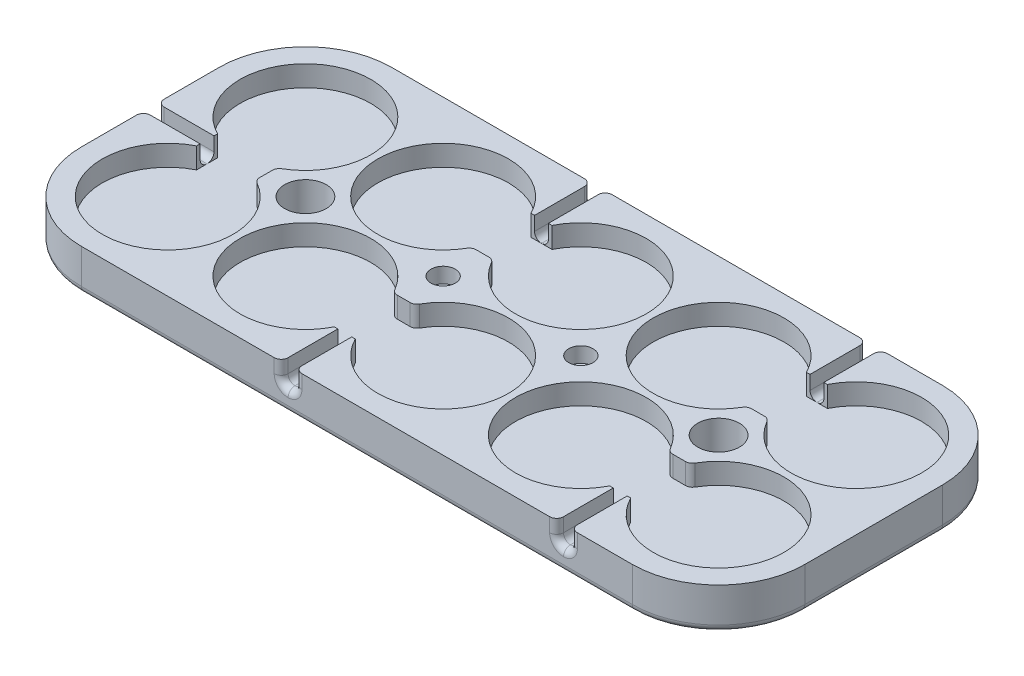
from build123d import *

# Parameters (mm, degrees)
SKETCH2_R               = 9.425
BOSS_EXTRUDE1_DEPTH     = 3
BOSS_EXTRUDE2_START     = -3
SKETCH3_R               = 12.425
BOSS_EXTRUDE2_DEPTH     = 3
SKETCH4_W               = 19.85
SKETCH4_H               = 8.5
SKETCH4_W_2             = 8.5
SKETCH4_H_2             = 19.85
CUT_EXTRUDE1_DEPTH      = 57.793821187
SKETCH5_W               = 2
SKETCH5_H               = 11.675
SKETCH5_W_2             = 11.675
SKETCH5_H_2             = 2
CUT_EXTRUDE2_DEPTH      = 57.793821187
CUT_EXTRUDE3_DEPTH      = 57.793821187
CUT_EXTRUDE3_DEPTH_BACK = 57.793821187
SKETCH7_R               = 3
SKETCH7_R_2             = 1.75
SKETCH8_R               = 3
CUT_EXTRUDE4_DEPTH      = 3.5
FILLET1_R               = 1
FILLET2_R               = 1
CUT_EXTRUDE5_DEPTH      = 0.5
SKETCH10_R              = 3
BOSS_EXTRUDE3_DEPTH     = 0.3


with BuildPart() as part:
    # Sketch2 → Boss-Extrude1 (new body)
    with BuildSketch(Plane(origin=(0, 0, 0), x_dir=(1, 0, 0), z_dir=(0, 1, 0))):
        with BuildLine():
            Line((-39.7, -22.35), (39.7, -22.35))
            ThreePointArc((39.7, -22.35), (48.485801756, -18.710801756), (52.125, -9.925))
            Line((52.125, -9.925), (52.125, 9.925))
            ThreePointArc((52.125, 9.925), (48.485801756, 18.710801756), (39.7, 22.35))
            Line((39.7, 22.35), (-39.7, 22.35))
            ThreePointArc((-39.7, 22.35), (-48.485801756, 18.710801756), (-52.125, 9.925))
            Line((-52.125, 9.925), (-52.125, -9.925))
            ThreePointArc((-52.125, -9.925), (-48.485801756, -18.710801756), (-39.7, -22.35))
        make_face()
        with Locations(Location((-19.85, 9.925, 0), (0, 0, 270))):
            Circle(SKETCH2_R, mode=Mode.SUBTRACT)
        with Locations(Location((-39.7, -9.925, 0), (0, 0, 270))):
            Circle(SKETCH2_R, mode=Mode.SUBTRACT)
        with Locations(Location((-39.7, 9.925, 0), (0, 0, 270))):
            Circle(SKETCH2_R, mode=Mode.SUBTRACT)
        with Locations(Location((-19.85, -9.925, 0), (0, 0, 270))):
            Circle(SKETCH2_R, mode=Mode.SUBTRACT)
        with Locations(Location((19.85, -9.925, 0), (0, 0, 270))):
            Circle(SKETCH2_R, mode=Mode.SUBTRACT)
        with Locations(Location((39.7, 9.925, 0), (0, 0, 270))):
            Circle(SKETCH2_R, mode=Mode.SUBTRACT)
        with Locations(Location((39.7, -9.925, 0), (0, 0, 270))):
            Circle(SKETCH2_R, mode=Mode.SUBTRACT)
        with Locations(Location((19.85, 9.925, 0), (0, 0, 270))):
            Circle(SKETCH2_R, mode=Mode.SUBTRACT)
        with Locations(Location((0, -9.925, 0), (0, 0, 270))):
            Circle(SKETCH2_R, mode=Mode.SUBTRACT)
        with Locations(Location((0, 9.925, 0), (0, 0, 270))):
            Circle(SKETCH2_R, mode=Mode.SUBTRACT)
    extrude(amount=BOSS_EXTRUDE1_DEPTH)

    # Sketch3 → Boss-Extrude2 (add)
    with BuildSketch(Plane(origin=(0, 0, 0), x_dir=(1, 0, 0), z_dir=(0, 1, 0)).offset(BOSS_EXTRUDE2_START)):
        with BuildLine():
            ThreePointArc((-27.275, -9.925), (-30.914198244, -18.710801756), (-39.7, -22.35))
            Line((-39.7, -22.35), (39.700000108, -22.35))
            ThreePointArc((39.700000108, -22.35), (27.916563549, -13.865970744), (32.225041806, 0))
            ThreePointArc((32.225041806, 0), (27.916563532, 13.865970693), (39.7, 22.35))
            Line((39.7, 22.35), (-39.7, 22.35))
            ThreePointArc((-39.7, 22.35), (-30.914198244, 18.710801756), (-27.275, 9.925))
            ThreePointArc((-27.275, 9.925), (-28.581165066, 4.379539269), (-32.225041806, 0))
            ThreePointArc((-32.225041806, 0), (-28.581165066, -4.379539269), (-27.275, -9.925))
        make_face()
        with Locations((-39.7, 9.925)):
            Circle(SKETCH3_R)
        with Locations((-39.7, -9.925)):
            Circle(SKETCH3_R)
        with BuildLine():
            Line((-52.125, 9.924999978), (-52.125, -9.925))
            ThreePointArc((-52.125, -9.925), (-50.818834934, -4.379539269), (-47.174958194, 0))
            ThreePointArc((-47.174958194, 0), (-50.818834929, 4.379539259), (-52.125, 9.924999978))
        make_face()
        with Locations((39.7, -9.925)):
            Circle(SKETCH3_R)
        with Locations((39.7, 9.925)):
            Circle(SKETCH3_R)
        with BuildLine():
            ThreePointArc((47.174958194, 0), (50.818834934, -4.379539269), (52.125, -9.925))
            Line((52.125, -9.925), (52.125, 9.925))
            ThreePointArc((52.125, 9.925), (50.818834934, 4.379539269), (47.174958194, 0))
        make_face()
    extrude(amount=BOSS_EXTRUDE2_DEPTH)

    # Sketch4 → Cut-Extrude1 (cut, through all)
    with BuildSketch(Plane(origin=(0, 0, 0), x_dir=(1, 0, 0), z_dir=(0, 1, 0))):
        with Locations((29.775, -9.925)):
            Rectangle(SKETCH4_W, SKETCH4_H)
        with Locations((-9.925, -9.925)):
            Rectangle(SKETCH4_W, SKETCH4_H)
        with Locations((-39.7, 0)):
            Rectangle(SKETCH4_W_2, SKETCH4_H_2)
        with Locations((-9.925, 9.925)):
            Rectangle(SKETCH4_W, SKETCH4_H)
        with Locations((29.775, 9.925)):
            Rectangle(SKETCH4_W, SKETCH4_H)
    extrude(amount=CUT_EXTRUDE1_DEPTH, mode=Mode.SUBTRACT)

    # Sketch5 → Cut-Extrude2 (cut, through all)
    with BuildSketch(Plane(origin=(0, 0, 0), x_dir=(1, 0, 0), z_dir=(0, 1, 0))):
        with Locations((-9.925, 16.5125)):
            Rectangle(SKETCH5_W, SKETCH5_H)
        with Locations((29.775, 16.5125)):
            Rectangle(SKETCH5_W, SKETCH5_H)
        with Locations((29.775, -16.5125)):
            Rectangle(SKETCH5_W, SKETCH5_H)
        with Locations((-9.925, -16.5125)):
            Rectangle(SKETCH5_W, SKETCH5_H)
        with Locations((-46.2875, 0)):
            Rectangle(SKETCH5_W_2, SKETCH5_H_2)
    extrude(amount=CUT_EXTRUDE2_DEPTH, mode=Mode.SUBTRACT)

    # Sketch7 → Cut-Extrude3 (cut, two sides: drawn at the far end of the back side and taken through both)
    with BuildSketch(Plane(origin=(0, 0, 0), x_dir=(1, 0, 0), z_dir=(0, 1, 0)).offset(-CUT_EXTRUDE3_DEPTH_BACK)):
        with Locations(Location((-29.775, 0, 0), (0, 0, 270))):
            Circle(SKETCH7_R)
        with Locations(Location((-9.925, 0, 0), (0, 0, 270))):
            Circle(SKETCH7_R_2)
        with Locations(Location((9.925, 0, 0), (0, 0, 270))):
            Circle(SKETCH7_R_2)
        with Locations(Location((29.775, 0, 0), (0, 0, 270))):
            Circle(SKETCH7_R)
    extrude(amount=CUT_EXTRUDE3_DEPTH + CUT_EXTRUDE3_DEPTH_BACK, mode=Mode.SUBTRACT)

    # Sketch8 → Cut-Extrude4 (cut)
    with BuildSketch(Plane.XZ.offset(3)):
        with Locations(Location((9.925, 0, 0), (0, 0, 270))):
            Circle(SKETCH8_R)
        with Locations(Location((-9.925, 0, 0), (0, 0, 270))):
            Circle(SKETCH8_R)
    extrude(amount=-CUT_EXTRUDE4_DEPTH, mode=Mode.SUBTRACT)

    # Fillet1
    fillet1_edges = [part.edges().sort_by_distance(p)[0] for p in [
        (28.775, 0, 18.2625),
        (30.775, 0, 18.2625),
        (-8.925, 0, 18.2625),
        (-10.925, 0, 18.2625),
        (-48.0375, 0, 1),
        (-48.0375, 0, -1),
        (-10.925, 0, -18.2625),
        (-8.925, 0, -18.2625),
        (28.775, 0, -18.2625),
        (30.775, 0, -18.2625),
    ]]
    fillet(fillet1_edges, radius=FILLET1_R - 0.0001)  # a hair under: the kernel refuses the full size
    fillet1_2_edges = [part.edges().sort_by_distance(p)[0] for p in [
        (28.775, 1.99995, 22.35),
        (30.775, 1.99995, 22.35),
        (-10.925, 1.99995, 22.35),
        (-8.925, 1.99995, 22.35),
        (-52.125, 1.99995, 1),
        (-52.125, 1.99995, -1),
        (-8.925, 1.99995, -22.35),
        (-10.925, 1.99995, -22.35),
        (30.775, 1.99995, -22.35),
        (28.775, 1.99995, -22.35),
        (28.262379271, 1.5, 5.675),
        (31.287620729, 1.5, 5.675),
        (-8.412379271, 1.5, 5.675),
        (-11.437620729, 1.5, 5.675),
        (-35.45, 1.5, -1.512620729),
        (-35.45, 1.5, 1.512620729),
        (-11.437620729, 1.5, -5.675),
        (-8.412379271, 1.5, -5.675),
        (28.262379271, 1.5, -5.675),
        (31.287620729, 1.5, -5.675),
        (29.067863929, 0.292863929, -22.35),
        (30.482136071, 0.292863929, -22.35),
        (-10.632136071, 0.292863929, -22.35),
        (-9.217863929, 0.292863929, -22.35),
        (-52.125, 0.292863929, -0.707136071),
        (-52.125, 0.292863929, 0.707136071),
        (-9.217863929, 0.292863929, 22.35),
        (-10.632136071, 0.292863929, 22.35),
        (30.482136071, 0.292863929, 22.35),
        (29.067863929, 0.292863929, 22.35),
    ]]
    fillet(fillet1_2_edges, radius=FILLET1_R)

    # Fillet2
    fillet2_edges = [part.edges().sort_by_distance(p)[0] for p in [
        (48.485801794, -3, 18.710801718),
        (5.4e-08, -3, 22.35),
        (-48.485801756, -3, 18.710801756),
        (-48.485801764, -3, -18.710801748),
        (48.485801756, -3, -18.710801756),
        (52.125, -3, 0),
        (-52.125, -3, 1.1e-08),
        (0, -3, -22.35),
    ]]
    fillet(fillet2_edges, radius=FILLET2_R)

    # Sketch9 → Cut-Extrude5 (cut)
    # profile 1 of 10: a face of its own
    with BuildSketch(Plane.XZ.offset(3)):
        Polygon((-41.93125, -3.371875), (-41.93125, -1.990625), (-40.30625, -1.990625), (-40.30625, -0.379589844), (-39.0875, -0.379589844), (-39.0875, -1.990625), (-37.4625, -1.990625), (-37.4625, -3.371875), (-39.0875, -3.371875), (-39.0875, -4.990527344), (-40.30625, -4.990527344), (-40.30625, -3.371875), align=None)
    # profile 2 of 10: a face of its own
    with BuildSketch(Plane.XZ.offset(3)):
        with BuildLine():
            Line((-37.70625, 1.155273438), (-37.70625, 3.003710938))
            Line((-37.70625, 3.003710938), (-38.913574219, 3.2296875))
            add(Edge.make_bspline(
                [(-38.913574219, 3.2296875), (-38.888354447, 3.195004202), (-38.838357858, 3.126246777), (-38.775816936, 3.016215044), (-38.719833196, 2.904684269), (-38.67723522, 2.78804962), (-38.642859865, 2.668424819), (-38.616912947, 2.545512106), (-38.603260829, 2.418768552), (-38.601095778, 2.333427364), (-38.6, 2.290234375)],
                knots=[0, 0, 0, 0, 1.019769699, 2.021628385, 3.008030164, 3.986378705, 4.97133988, 5.968784958, 6.971958885, 8, 8, 8, 8], degree=3))
            add(Edge.make_bspline(
                [(-38.6, 2.290234375), (-38.601776673, 2.216478332), (-38.605285814, 2.070801375), (-38.638472169, 1.856507366), (-38.690195164, 1.649702893), (-38.762963563, 1.451812524), (-38.852441456, 1.264849333), (-38.957887633, 1.090464117), (-39.076393572, 0.928545879), (-39.212214447, 0.783101653), (-39.357772298, 0.650132327), (-39.515952873, 0.534442847), (-39.684877452, 0.434760373), (-39.863331803, 0.35124336), (-40.050292843, 0.284690145), (-40.244416524, 0.238412025), (-40.444476066, 0.207371634), (-40.580350356, 0.204550731), (-40.649023437, 0.203125)],
                knots=[0, 0, 0, 0, 1.08625284, 2.145478562, 3.187603353, 4.223364536, 5.24703985, 6.237405749, 7.222752121, 8.198101564, 9.165041285, 10.124227595, 11.080388489, 12.051261812, 13.023656128, 13.999244784, 14.988785689, 16, 16, 16, 16], degree=3))
            add(Edge.make_bspline(
                [(-40.649023437, 0.203125), (-40.748287249, 0.206500481), (-40.943979002, 0.213155008), (-41.230986695, 0.267278708), (-41.506409805, 0.353523058), (-41.724281776, 0.45550631), (-41.89025101, 0.553052891), (-42.00877063, 0.636245926), (-42.121501816, 0.727539988), (-42.228798042, 0.826832695), (-42.329203199, 0.935167651), (-42.423474592, 1.052200786), (-42.510461285, 1.178515088), (-42.59360878, 1.311000229), (-42.666782038, 1.451604635), (-42.730391319, 1.598533193), (-42.78537166, 1.751002104), (-42.829267075, 1.909391367), (-42.864081019, 2.073003985), (-42.887445682, 2.242319957), (-42.903514638, 2.417302861), (-42.905330585, 2.536063056), (-42.90625, 2.596191406)],
                knots=[0, 0, 0, 0, 1.614845366, 3.183556158, 4.736945776, 6.3025528, 7.087021627, 7.868642129, 8.657243818, 9.446897877, 10.24628748, 11.059624568, 11.890909107, 12.741604561, 13.604347575, 14.468189976, 15.346307227, 16.240516445, 17.141677189, 18.067180109, 19.021412259, 20, 20, 20, 20], degree=3))
            add(Edge.make_bspline(
                [(-42.90625, 2.596191406), (-42.905064552, 2.659260334), (-42.902739024, 2.782984469), (-42.890746152, 2.964073511), (-42.867733633, 3.136163094), (-42.835714553, 3.298786798), (-42.797210898, 3.453224783), (-42.7475896, 3.597878655), (-42.688840905, 3.733654406), (-42.600751388, 3.898698676), (-42.478712582, 4.084235441), (-42.318070744, 4.276878388), (-42.146291593, 4.435985956), (-41.963119588, 4.555142779), (-41.780882792, 4.643988216), (-41.608320574, 4.710093255), (-41.445241965, 4.751180813), (-41.339428964, 4.756791595), (-41.288867188, 4.759472656)],
                knots=[0, 0, 0, 0, 1.013582185, 1.988373401, 2.914513124, 3.801374318, 4.650762859, 5.470085016, 6.255844122, 7.025459743, 8.473948101, 9.815657502, 11.047961438, 12.221074907, 13.312848151, 14.300551696, 15.187934143, 16, 16, 16, 16], degree=3))
            add(Edge.make_bspline(
                [(-41.288867188, 4.759472656), (-41.256500223, 4.757413713), (-41.191716453, 4.753292656), (-41.096203093, 4.722540138), (-41.005743276, 4.669822799), (-40.919535264, 4.601596699), (-40.844409247, 4.518029499), (-40.7904347, 4.420306725), (-40.755243869, 4.312855213), (-40.752163764, 4.237130747), (-40.750585937, 4.198339844)],
                knots=[0, 0, 0, 0, 0.904042773, 1.809477692, 2.773527107, 3.817381096, 4.873497324, 5.890390631, 6.919323454, 8, 8, 8, 8], degree=3))
            add(Edge.make_bspline(
                [(-40.750585937, 4.198339844), (-40.752154462, 4.159744719), (-40.755176802, 4.085377018), (-40.775458965, 3.977739743), (-40.811256871, 3.879239982), (-40.861353473, 3.789210338), (-40.92534359, 3.70820298), (-41.004961529, 3.637613685), (-41.097666395, 3.575222495), (-41.166930612, 3.542375029), (-41.202539063, 3.525488281)],
                knots=[0, 0, 0, 0, 1.070872181, 2.063429057, 3.025512209, 3.966438538, 4.910875251, 5.875320226, 6.907710805, 8, 8, 8, 8], degree=3))
            add(Edge.make_bspline(
                [(-41.202539063, 3.525488281), (-41.261732716, 3.496869957), (-41.375089147, 3.442065584), (-41.525854614, 3.340448049), (-41.653944646, 3.23126204), (-41.756104899, 3.111247627), (-41.834498163, 2.984668147), (-41.889660873, 2.853536704), (-41.924574856, 2.718175964), (-41.929016786, 2.626019738), (-41.93125, 2.5796875)],
                knots=[0, 0, 0, 0, 1.246173256, 2.38643411, 3.439441567, 4.430594302, 5.364333449, 6.253179032, 7.121772564, 8, 8, 8, 8], degree=3))
            add(Edge.make_bspline(
                [(-41.93125, 2.5796875), (-41.929949637, 2.53083351), (-41.927425054, 2.435986163), (-41.895947262, 2.299075778), (-41.85020936, 2.171205783), (-41.78262806, 2.054271989), (-41.698641709, 1.949177595), (-41.599342386, 1.854825097), (-41.484420918, 1.773920323), (-41.355351723, 1.705043174), (-41.213794743, 1.650695799), (-41.061382418, 1.613637776), (-40.900407726, 1.587957318), (-40.78962488, 1.585589355), (-40.7328125, 1.584375)],
                knots=[0, 0, 0, 0, 1.004414075, 1.950014914, 2.879565473, 3.793282912, 4.717750338, 5.642751983, 6.605517642, 7.603974128, 8.649867825, 9.719756986, 10.830630925, 12, 12, 12, 12], degree=3))
            add(Edge.make_bspline(
                [(-40.7328125, 1.584375), (-40.672223282, 1.586183284), (-40.555615568, 1.58966344), (-40.387547428, 1.613329623), (-40.233992195, 1.655235913), (-40.094919341, 1.713604175), (-39.971823569, 1.786307292), (-39.863429357, 1.868611369), (-39.773237248, 1.964001127), (-39.700930381, 2.069857725), (-39.644578647, 2.184174186), (-39.604035406, 2.304952897), (-39.578874181, 2.432228716), (-39.576305455, 2.51905667), (-39.575, 2.563183594)],
                knots=[0, 0, 0, 0, 1.27823599, 2.46004456, 3.571179967, 4.627444697, 5.631916714, 6.58018035, 7.489612449, 8.38855397, 9.274949741, 10.169936726, 11.069941664, 12, 12, 12, 12], degree=3))
            add(Edge.make_bspline(
                [(-39.575, 2.563183594), (-39.575271785, 2.609800224), (-39.575772414, 2.69566841), (-39.590472202, 2.813171966), (-39.609477648, 2.910222396), (-39.645019257, 2.991622727), (-39.697867096, 3.071063721), (-39.76276327, 3.170276159), (-39.851266145, 3.292073184), (-39.956547873, 3.429253872), (-40.058691479, 3.576019475), (-40.134617241, 3.725040571), (-40.183308124, 3.868655764), (-40.190031034, 3.963569179), (-40.193261719, 4.009179688)],
                knots=[0, 0, 0, 0, 1.040838944, 1.917233242, 2.644627811, 3.242022575, 3.887710035, 4.774405358, 5.892648842, 7.250913045, 8.641303185, 9.880711888, 10.98157908, 12, 12, 12, 12], degree=3))
            add(Edge.make_bspline(
                [(-40.193261719, 4.009179688), (-40.191621724, 4.048377277), (-40.188386183, 4.125710094), (-40.153057046, 4.236760628), (-40.098712453, 4.340473578), (-40.024620072, 4.434299595), (-39.935957371, 4.512586522), (-39.839553004, 4.573757691), (-39.734399746, 4.609365368), (-39.662000643, 4.613798063), (-39.62578125, 4.616015625)],
                knots=[0, 0, 0, 0, 1.023616867, 2.019490913, 3.021024079, 4.078760992, 5.130907536, 6.10614948, 7.052555734, 8, 8, 8, 8], degree=3))
            add(Edge.make_bspline(
                [(-39.62578125, 4.616015625), (-39.615186891, 4.615300431), (-39.584519577, 4.613230172), (-39.524661358, 4.602624129), (-39.435610549, 4.589573573), (-39.366762869, 4.577314252), (-39.327441406, 4.5703125)],
                knots=[0, 0, 0, 0, 0.421823084, 1.221044272, 2.412835351, 4, 4, 4, 4], degree=3))
            Line((-39.327441406, 4.5703125), (-37.317773438, 4.217382813))
            add(Edge.make_bspline(
                [(-37.317773438, 4.217382813), (-37.258132131, 4.205820351), (-37.145079254, 4.183903165), (-36.990111419, 4.128784716), (-36.858236368, 4.061045553), (-36.74940187, 3.975646089), (-36.665980854, 3.866331322), (-36.607857209, 3.732452168), (-36.574078383, 3.572413006), (-36.570608649, 3.457533915), (-36.56875, 3.395996094)],
                knots=[0, 0, 0, 0, 1.170661162, 2.219042838, 3.16128212, 4.020649716, 4.864876015, 5.785830123, 6.813925249, 8, 8, 8, 8], degree=3))
            Line((-36.56875, 3.395996094), (-36.56875, 1.180664063))
            add(Edge.make_bspline(
                [(-36.56875, 1.180664063), (-36.570244509, 1.117513411), (-36.573048509, 0.999030018), (-36.598922153, 0.832998107), (-36.64375982, 0.692019237), (-36.706355812, 0.574658767), (-36.788915033, 0.482526216), (-36.892263991, 0.418924186), (-37.012415083, 0.37938413), (-37.098664246, 0.375353642), (-37.143847656, 0.373242188)],
                knots=[0, 0, 0, 0, 1.344730686, 2.522986704, 3.56640363, 4.482312437, 5.337369367, 6.167786367, 7.040156946, 8, 8, 8, 8], degree=3))
            add(Edge.make_bspline(
                [(-37.143847656, 0.373242188), (-37.180989021, 0.375686162), (-37.254619477, 0.380531191), (-37.360219201, 0.419751035), (-37.457465456, 0.48256755), (-37.545357459, 0.569473642), (-37.618804015, 0.681827257), (-37.669899338, 0.81959761), (-37.701705498, 0.979902254), (-37.704677532, 1.094592318), (-37.70625, 1.155273438)],
                knots=[0, 0, 0, 0, 0.826265408, 1.638019978, 2.478174968, 3.392219469, 4.373568936, 5.445905295, 6.648659502, 8, 8, 8, 8], degree=3))
        make_face()
    # profile 3 of 10: a face of its own
    with BuildSketch(Plane.XZ.offset(3)):
        with BuildLine():
            add(Edge.make_bspline(
                [(-12.644335938, -9.15), (-12.586589295, -9.147582359), (-12.474091138, -9.142872472), (-12.311915745, -9.105572296), (-12.163347415, -9.042279828), (-12.051384837, -8.969371804), (-11.97217234, -8.898824265), (-11.919560064, -8.840473608), (-11.876227225, -8.776085445), (-11.840068951, -8.706791468), (-11.812515968, -8.631604667), (-11.791864361, -8.551305474), (-11.780599872, -8.465197797), (-11.779225011, -8.406085877), (-11.778515625, -8.375585937)],
                knots=[0, 0, 0, 0, 1.588922051, 3.095431968, 4.55195291, 6.015911772, 6.750344642, 7.468325924, 8.172850126, 8.881601128, 9.615294202, 10.372660857, 11.160342861, 12, 12, 12, 12], degree=3))
            add(Edge.make_bspline(
                [(-11.778515625, -8.375585937), (-11.780940094, -8.330052772), (-11.785691884, -8.240810968), (-11.823822553, -8.112128419), (-11.887968431, -7.994282978), (-11.975196924, -7.887981674), (-12.084712501, -7.79845234), (-12.214276886, -7.732478802), (-12.362858552, -7.693877677), (-12.467635013, -7.689690832), (-12.522460938, -7.6875)],
                knots=[0, 0, 0, 0, 0.962640342, 1.886707414, 2.812509498, 3.786255046, 4.779539858, 5.785068332, 6.841002323, 8, 8, 8, 8], degree=3))
            add(Edge.make_bspline(
                [(-12.522460938, -7.6875), (-12.555893358, -7.68845483), (-12.61907575, -7.690259319), (-12.709115615, -7.69763789), (-12.787914773, -7.716240426), (-12.878015535, -7.745225047), (-12.97626107, -7.799416903), (-13.055833756, -7.876336891), (-13.111969883, -7.95019182), (-13.154385131, -8.017107139), (-13.197730261, -8.095880701), (-13.256803449, -8.212651726), (-13.323681873, -8.361985016), (-13.377636746, -8.480143129), (-13.403515625, -8.536816406)],
                knots=[0, 0, 0, 0, 0.904989055, 1.710297113, 2.437899308, 3.089491427, 4.268063784, 5.434116808, 6.054598845, 6.775415668, 7.574844294, 8.486110305, 10.314600321, 12, 12, 12, 12], degree=3))
            add(Edge.make_bspline(
                [(-13.403515625, -8.536816406), (-13.41302027, -8.550954521), (-13.433325345, -8.581158224), (-13.480679061, -8.616863538), (-13.53823644, -8.65334666), (-13.635298497, -8.695971687), (-13.774075258, -8.737657299), (-13.891485891, -8.742516838), (-13.951953125, -8.745019531)],
                knots=[0, 0, 0, 0, 0.502291102, 1.073060463, 1.738596173, 2.525307356, 4.210510845, 6, 6, 6, 6], degree=3))
            add(Edge.make_bspline(
                [(-13.951953125, -8.745019531), (-13.985181842, -8.743021688), (-14.05125056, -8.739049373), (-14.147115058, -8.708183309), (-14.237720225, -8.658484248), (-14.321772836, -8.591107602), (-14.393069129, -8.505978915), (-14.44641057, -8.406492568), (-14.477340641, -8.29318124), (-14.480814633, -8.213700964), (-14.482617188, -8.172460937)],
                knots=[0, 0, 0, 0, 0.917417596, 1.824103036, 2.756029669, 3.762874785, 4.784566943, 5.805253663, 6.861209319, 8, 8, 8, 8], degree=3))
            add(Edge.make_bspline(
                [(-14.482617188, -8.172460937), (-14.480891173, -8.132528572), (-14.477383604, -8.051378903), (-14.448459629, -7.929611354), (-14.405467507, -7.8058502), (-14.34381658, -7.681113715), (-14.26473047, -7.557513354), (-14.171106846, -7.435350375), (-14.060202835, -7.31851195), (-13.936593493, -7.203785781), (-13.795657962, -7.096812922), (-13.637030341, -7.002319984), (-13.464000624, -6.916237398), (-13.274759035, -6.845389665), (-13.073394321, -6.784443617), (-12.859338609, -6.743803327), (-12.635255664, -6.717570556), (-12.48233597, -6.714211879), (-12.404394531, -6.7125)],
                knots=[0, 0, 0, 0, 0.687665124, 1.397457831, 2.147322746, 2.943422878, 3.789436066, 4.673713908, 5.592469244, 6.563166905, 7.578694088, 8.635921147, 9.741960392, 10.905797436, 12.115380376, 13.36442633, 14.656677908, 16, 16, 16, 16], degree=3))
            add(Edge.make_bspline(
                [(-12.404394531, -6.7125), (-12.331976646, -6.713946261), (-12.189731242, -6.716787052), (-11.980687817, -6.73965201), (-11.780982322, -6.779540097), (-11.590535658, -6.832216833), (-11.410781888, -6.899680252), (-11.243389169, -6.980240325), (-11.089083863, -7.075320499), (-10.949347977, -7.1827752), (-10.823235744, -7.299028235), (-10.714381777, -7.424024122), (-10.623515778, -7.557147123), (-10.549904588, -7.697058206), (-10.492481757, -7.842254448), (-10.451615223, -7.992064305), (-10.426776393, -8.145810148), (-10.424032102, -8.249811808), (-10.42265625, -8.301953125)],
                knots=[0, 0, 0, 0, 1.225107078, 2.406392441, 3.552210207, 4.667510872, 5.746030394, 6.796375209, 7.805802999, 8.80681598, 9.774471105, 10.703308983, 11.604924289, 12.495296676, 13.372823065, 14.241306182, 15.118277406, 16, 16, 16, 16], degree=3))
            add(Edge.make_bspline(
                [(-10.42265625, -8.301953125), (-10.424528504, -8.369851517), (-10.428160533, -8.501569149), (-10.465660085, -8.692165283), (-10.522577058, -8.869952115), (-10.607625328, -9.033167057), (-10.712010729, -9.184047461), (-10.830902664, -9.329289585), (-10.967621203, -9.466021724), (-11.0693556, -9.548659594), (-11.120898438, -9.590527344)],
                knots=[0, 0, 0, 0, 1.068493578, 2.072794954, 3.049015524, 4.000257127, 4.960059425, 5.935847279, 6.954215185, 8, 8, 8, 8], degree=3))
            add(Edge.make_bspline(
                [(-11.120898438, -9.590527344), (-11.073819925, -9.615015052), (-10.978805602, -9.66443639), (-10.845138981, -9.755692998), (-10.715983066, -9.857286426), (-10.595279046, -9.971008871), (-10.484142726, -10.092673), (-10.387383491, -10.220868252), (-10.306045467, -10.354211158), (-10.241884761, -10.493058001), (-10.190227221, -10.635576958), (-10.154840857, -10.783353503), (-10.132702947, -10.935559307), (-10.129659072, -11.038987093), (-10.128125, -11.091113281)],
                knots=[0, 0, 0, 0, 1.00625233, 2.030828509, 3.065551735, 4.122322673, 5.174108021, 6.189198351, 7.165688209, 8.132120304, 9.087207882, 10.037726527, 11.011041016, 12, 12, 12, 12], degree=3))
            add(Edge.make_bspline(
                [(-10.128125, -11.091113281), (-10.130165435, -11.153857543), (-10.134254184, -11.279588373), (-10.164851929, -11.467112668), (-10.212933262, -11.653559573), (-10.281611942, -11.836816833), (-10.36876837, -12.015409852), (-10.478256887, -12.184715338), (-10.605042559, -12.346900444), (-10.753082013, -12.497534547), (-10.917650561, -12.636910806), (-11.098951514, -12.762792432), (-11.298711082, -12.869801858), (-11.512416632, -12.964270628), (-11.741083876, -13.039260491), (-11.982716003, -13.091830008), (-12.235816717, -13.126400745), (-12.40893251, -13.129614031), (-12.497070313, -13.13125)],
                knots=[0, 0, 0, 0, 0.865116607, 1.733574129, 2.614147439, 3.517277987, 4.42829596, 5.349596062, 6.293093627, 7.26308448, 8.257066179, 9.264123562, 10.301066281, 11.377915821, 12.483550515, 13.613627803, 14.785035159, 16, 16, 16, 16], degree=3))
            add(Edge.make_bspline(
                [(-12.497070313, -13.13125), (-12.582258819, -13.1292133), (-12.748282205, -13.125243988), (-12.990682235, -13.089653256), (-13.219627024, -13.033731426), (-13.433347684, -12.952671051), (-13.630294318, -12.855248796), (-13.810645858, -12.745333356), (-13.973988485, -12.625347517), (-14.117587596, -12.492712119), (-14.24247209, -12.352446913), (-14.353739821, -12.210578569), (-14.448395192, -12.06544214), (-14.524850341, -11.919096321), (-14.585562014, -11.777627316), (-14.628600317, -11.645418812), (-14.658209738, -11.525314873), (-14.662258651, -11.448418021), (-14.664160156, -11.412304687)],
                knots=[0, 0, 0, 0, 1.352749266, 2.636365181, 3.883815623, 5.090148188, 6.259800183, 7.370213415, 8.4419304, 9.474464176, 10.469453221, 11.422962127, 12.336745574, 13.217916145, 14.043357411, 14.779004771, 15.426579817, 16, 16, 16, 16], degree=3))
            add(Edge.make_bspline(
                [(-14.664160156, -11.412304687), (-14.662172628, -11.368453451), (-14.658323528, -11.28353), (-14.622672954, -11.163488813), (-14.56638764, -11.055769392), (-14.484751919, -10.966377968), (-14.388546694, -10.892394923), (-14.2790546, -10.83845913), (-14.158667768, -10.805491726), (-14.074886988, -10.802119516), (-14.031933594, -10.800390625)],
                knots=[0, 0, 0, 0, 1.065566147, 2.063603226, 3.022673671, 4.000932909, 4.986224236, 5.963342773, 6.955830415, 8, 8, 8, 8], degree=3))
            add(Edge.make_bspline(
                [(-14.031933594, -10.800390625), (-14.002666143, -10.801794939), (-13.944940466, -10.804564739), (-13.859637005, -10.821158405), (-13.777774135, -10.8509411), (-13.701486485, -10.891149907), (-13.632936946, -10.934969535), (-13.578485452, -10.981272974), (-13.534325129, -11.024673782), (-13.518660916, -11.058832037), (-13.511425781, -11.074609375)],
                knots=[0, 0, 0, 0, 1.143080217, 2.2545551, 3.37824436, 4.53107536, 5.617207074, 6.543824975, 7.327408127, 8, 8, 8, 8], degree=3))
            add(Edge.make_bspline(
                [(-13.511425781, -11.074609375), (-13.493041362, -11.122097691), (-13.457404333, -11.214150774), (-13.401927923, -11.346010299), (-13.345763034, -11.466328867), (-13.29172731, -11.576773209), (-13.235203198, -11.6750464), (-13.181814235, -11.764974702), (-13.125113347, -11.841893222), (-13.054741228, -11.931334098), (-12.954113549, -12.022334233), (-12.814752565, -12.101141399), (-12.656618949, -12.148412233), (-12.545641587, -12.153576319), (-12.488183594, -12.15625)],
                knots=[0, 0, 0, 0, 1.14566123, 2.220791496, 3.217566238, 4.132996771, 4.985623846, 5.767776728, 6.483862468, 7.133650454, 8.326789082, 9.507709648, 10.709628707, 12, 12, 12, 12], degree=3))
            add(Edge.make_bspline(
                [(-12.488183594, -12.15625), (-12.448300098, -12.154729556), (-12.368801488, -12.151698901), (-12.250871417, -12.128832993), (-12.134930035, -12.093974393), (-12.023232757, -12.042277543), (-11.916028678, -11.978677821), (-11.819172411, -11.897082806), (-11.730919734, -11.802753836), (-11.653670977, -11.694442543), (-11.588274185, -11.574960451), (-11.543253331, -11.443981752), (-11.513744329, -11.305288594), (-11.510852799, -11.209760075), (-11.509375, -11.1609375)],
                knots=[0, 0, 0, 0, 0.9235703, 1.840925773, 2.774487623, 3.722307052, 4.685870479, 5.653814215, 6.645891586, 7.671748793, 8.728990655, 9.789591876, 10.870307882, 12, 12, 12, 12], degree=3))
            add(Edge.make_bspline(
                [(-11.509375, -11.1609375), (-11.510091901, -11.124517442), (-11.511496046, -11.053183981), (-11.522828816, -10.949515094), (-11.542207581, -10.851935402), (-11.567765494, -10.760324999), (-11.604775505, -10.676149231), (-11.645748341, -10.596352767), (-11.69733079, -10.524400137), (-11.754566009, -10.457502539), (-11.818936391, -10.398325553), (-11.889871925, -10.346414914), (-11.967438737, -10.303876292), (-12.050988525, -10.267520217), (-12.14098662, -10.240316422), (-12.237255457, -10.219368675), (-12.339816825, -10.208461465), (-12.410296933, -10.206997569), (-12.446289063, -10.20625)],
                knots=[0, 0, 0, 0, 1.150351983, 2.253115219, 3.288686571, 4.291290674, 5.249697225, 6.188606808, 7.119488109, 8.038778818, 8.965909071, 9.87503508, 10.808600146, 11.754714714, 12.748366816, 13.773531894, 14.86300785, 16, 16, 16, 16], degree=3))
            add(Edge.make_bspline(
                [(-12.446289063, -10.20625), (-12.460254765, -10.206642324), (-12.49285208, -10.207558046), (-12.548752242, -10.209994192), (-12.61857927, -10.21531837), (-12.696824057, -10.222601441), (-12.774190493, -10.230212325), (-12.840640671, -10.235383631), (-12.89230315, -10.237926815), (-12.921515898, -10.238864051), (-12.933789063, -10.239257812)],
                knots=[0, 0, 0, 0, 0.68607079, 1.601356213, 2.747301521, 4.124469278, 5.460252047, 6.564749978, 7.397007756, 8, 8, 8, 8], degree=3))
            add(Edge.make_bspline(
                [(-12.933789063, -10.239257812), (-12.975846491, -10.237765763), (-13.055830253, -10.234928222), (-13.168720226, -10.207809289), (-13.267539034, -10.163103444), (-13.351342723, -10.100026347), (-13.418962978, -10.020620385), (-13.463938887, -9.924797924), (-13.495195455, -9.817607125), (-13.49751724, -9.741004578), (-13.498730469, -9.700976562)],
                knots=[0, 0, 0, 0, 1.139920524, 2.167872241, 3.128901249, 4.063837875, 4.993255263, 5.928121337, 6.917357245, 8, 8, 8, 8], degree=3))
            add(Edge.make_bspline(
                [(-13.498730469, -9.700976562), (-13.49666334, -9.661349631), (-13.492671947, -9.584834472), (-13.45806842, -9.476497656), (-13.402742805, -9.379777376), (-13.322942069, -9.298238), (-13.224463881, -9.229088442), (-13.103460648, -9.183970858), (-12.965778022, -9.153464922), (-12.867544345, -9.151196612), (-12.815722656, -9.15)],
                knots=[0, 0, 0, 0, 0.958765127, 1.851267899, 2.72949922, 3.636745432, 4.595949755, 5.623009295, 6.746054562, 8, 8, 8, 8], degree=3))
            Line((-12.815722656, -9.15), (-12.644335938, -9.15))
        make_face()
    # profile 4 of 10: a face of its own
    with BuildSketch(Plane.XZ.offset(3)):
        Polygon((-6.471875, -12.15625), (-7.853125, -12.15625), (-7.853125, -10.53125), (-9.464160156, -10.53125), (-9.464160156, -9.3125), (-7.853125, -9.3125), (-7.853125, -7.6875), (-6.471875, -7.6875), (-6.471875, -9.3125), (-4.853222656, -9.3125), (-4.853222656, -10.53125), (-6.471875, -10.53125), align=None)
    # profile 5 of 10: a face of its own
    with BuildSketch(Plane.XZ.offset(3)):
        with BuildLine():
            Line((27.053125, -12.374609375), (27.053125, -8.6625))
            add(Edge.make_bspline(
                [(27.053125, -8.6625), (26.979944455, -8.726509359), (26.840597494, -8.848392978), (26.634719199, -9.014058908), (26.443220829, -9.154540992), (26.265760468, -9.269291534), (26.103242331, -9.359552976), (25.955287695, -9.424191534), (25.821400492, -9.466001372), (25.735587296, -9.472159059), (25.695996094, -9.475)],
                knots=[0, 0, 0, 0, 1.452107273, 2.765034543, 3.945897232, 4.997908399, 5.920070119, 6.718510474, 7.408765629, 8, 8, 8, 8], degree=3))
            add(Edge.make_bspline(
                [(25.695996094, -9.475), (25.661464927, -9.473171665), (25.59352586, -9.469574468), (25.495461534, -9.436862989), (25.404060141, -9.385215137), (25.321817552, -9.314623785), (25.251979548, -9.230899408), (25.202110268, -9.136470935), (25.169583554, -9.035729467), (25.165916009, -8.965741645), (25.1640625, -8.930371094)],
                knots=[0, 0, 0, 0, 0.982678269, 1.933390929, 2.917255113, 3.962257531, 5.008793131, 6.008019064, 6.993289668, 8, 8, 8, 8], degree=3))
            add(Edge.make_bspline(
                [(25.1640625, -8.930371094), (25.166036929, -8.890862814), (25.169766361, -8.816236945), (25.196640189, -8.712076953), (25.246535437, -8.625675278), (25.319120664, -8.55687971), (25.413276608, -8.497522375), (25.527120001, -8.432096549), (25.664722355, -8.359137261), (25.765997691, -8.312028824), (25.820410156, -8.28671875)],
                knots=[0, 0, 0, 0, 0.959800551, 1.812935176, 2.587130183, 3.350598702, 4.217563363, 5.286346087, 6.542028024, 8, 8, 8, 8], degree=3))
            add(Edge.make_bspline(
                [(25.820410156, -8.28671875), (25.89961768, -8.248313814), (26.051674652, -8.174586749), (26.262901123, -8.053188612), (26.450881492, -7.931219543), (26.614380281, -7.801801527), (26.761694496, -7.666615362), (26.899649196, -7.525567274), (27.028451693, -7.374269813), (27.145986867, -7.220314252), (27.248850919, -7.075366727), (27.338586235, -6.956674274), (27.40876611, -6.867865348), (27.461517536, -6.80130718), (27.519543306, -6.757051608), (27.591933847, -6.730303434), (27.681689479, -6.714494009), (27.747478695, -6.713200482), (27.783105469, -6.7125)],
                knots=[0, 0, 0, 0, 1.633066382, 3.135044738, 4.518110351, 5.78750681, 6.999314836, 8.226621731, 9.446368142, 10.684082489, 11.819758467, 12.744847819, 13.443941736, 13.922653104, 14.315303366, 14.780490369, 15.339600077, 16, 16, 16, 16], degree=3))
            add(Edge.make_bspline(
                [(27.783105469, -6.7125), (27.833749765, -6.714564687), (27.930416845, -6.71850565), (28.065900969, -6.758521443), (28.181423821, -6.825851364), (28.273386882, -6.920066276), (28.34506961, -7.030804805), (28.398285197, -7.154696051), (28.428994833, -7.291614602), (28.432541708, -7.386888225), (28.434375, -7.436132812)],
                knots=[0, 0, 0, 0, 1.104026993, 2.107306726, 3.052283825, 3.993636142, 4.95520013, 5.920268712, 6.92503816, 8, 8, 8, 8], degree=3))
            Line((28.434375, -7.436132812), (28.434375, -12.212109375))
            add(Edge.make_bspline(
                [(28.434375, -12.212109375), (28.432498372, -12.284208438), (28.428974174, -12.419606243), (28.395121664, -12.608495934), (28.339018113, -12.770048877), (28.256877173, -12.902697244), (28.15071227, -13.007504376), (28.020097367, -13.080544827), (27.866749757, -13.12493469), (27.75719241, -13.129067013), (27.699316406, -13.13125)],
                knots=[0, 0, 0, 0, 1.286563032, 2.416089802, 3.413012509, 4.323048118, 5.178141009, 6.048034207, 6.968832458, 8, 8, 8, 8], degree=3))
            add(Edge.make_bspline(
                [(27.699316406, -13.13125), (27.652921199, -13.128924878), (27.563206753, -13.124428788), (27.43580847, -13.086393407), (27.322717997, -13.024173469), (27.225024341, -12.938036212), (27.14575501, -12.827883281), (27.092564536, -12.694469319), (27.058730763, -12.541319222), (27.055067049, -12.432363985), (27.053125, -12.374609375)],
                knots=[0, 0, 0, 0, 0.988661812, 1.911776046, 2.809258143, 3.724383738, 4.669377512, 5.677528055, 6.768912233, 8, 8, 8, 8], degree=3))
        make_face()
    # profile 6 of 10: a face of its own
    with BuildSketch(Plane.XZ.offset(3)):
        Polygon((33.228125, -12.15625), (31.846875, -12.15625), (31.846875, -10.53125), (30.235839844, -10.53125), (30.235839844, -9.3125), (31.846875, -9.3125), (31.846875, -7.6875), (33.228125, -7.6875), (33.228125, -9.3125), (34.846777344, -9.3125), (34.846777344, -10.53125), (33.228125, -10.53125), align=None)
    # profile 7 of 10: a face of its own
    with BuildSketch(Plane.XZ.offset(3)):
        Polygon((-13.296875, 12.15625), (-11.915625, 12.15625), (-11.915625, 10.53125), (-10.304589844, 10.53125), (-10.304589844, 9.3125), (-11.915625, 9.3125), (-11.915625, 7.6875), (-13.296875, 7.6875), (-13.296875, 9.3125), (-14.915527344, 9.3125), (-14.915527344, 10.53125), (-13.296875, 10.53125), align=None)
    # profile 8 of 10: a face of its own
    with BuildSketch(Plane.XZ.offset(3)):
        with BuildLine():
            Line((-6.111328125, 6.79375), (-8.882714844, 6.79375))
            add(Edge.make_bspline(
                [(-8.882714844, 6.79375), (-8.956019708, 6.795558278), (-9.093139541, 6.798940737), (-9.284280545, 6.8269369), (-9.445345622, 6.875624976), (-9.578308885, 6.943472139), (-9.679242806, 7.035681817), (-9.753001122, 7.144889444), (-9.796202215, 7.274395314), (-9.80074669, 7.366400638), (-9.803125, 7.414550781)],
                knots=[0, 0, 0, 0, 1.397524503, 2.614128378, 3.670777721, 4.594979365, 5.434717071, 6.249382308, 7.083830275, 8, 8, 8, 8], degree=3))
            add(Edge.make_bspline(
                [(-9.803125, 7.414550781), (-9.799813925, 7.447013413), (-9.792465431, 7.519059931), (-9.747332677, 7.631194479), (-9.679009515, 7.757487072), (-9.546992118, 7.949022358), (-9.352959033, 8.208367075), (-9.143625615, 8.480061398), (-8.967521958, 8.718606683), (-8.832391827, 8.923071558), (-8.695681066, 9.149094673), (-8.552815272, 9.395662004), (-8.412955421, 9.670501901), (-8.278576557, 9.976607597), (-8.149200444, 10.314366294), (-8.071279305, 10.552466932), (-8.030859375, 10.675976562)],
                knots=[0, 0, 0, 0, 0.364752869, 0.809520756, 1.34290563, 1.976566009, 3.416776449, 4.979517695, 5.826024076, 6.744239749, 7.729116823, 8.790766734, 9.942121766, 11.188331002, 12.541506644, 14, 14, 14, 14], degree=3))
            add(Edge.make_bspline(
                [(-8.030859375, 10.675976562), (-8.015315668, 10.726668441), (-7.986137449, 10.821825844), (-7.949541704, 10.957571847), (-7.918788554, 11.075905851), (-7.894148506, 11.184704795), (-7.873140608, 11.297068049), (-7.849764668, 11.425928541), (-7.827900634, 11.579004019), (-7.803551499, 11.747450052), (-7.779556261, 11.915958437), (-7.756825746, 12.068808622), (-7.73604419, 12.197631623), (-7.720446787, 12.275199477), (-7.713476563, 12.309863281)],
                knots=[0, 0, 0, 0, 1.145189013, 2.149717393, 3.036513212, 3.786056174, 4.558707927, 5.505472634, 6.614636166, 7.898287701, 9.181939235, 10.291102768, 11.236321808, 12, 12, 12, 12], degree=3))
            add(Edge.make_bspline(
                [(-7.713476563, 12.309863281), (-7.698078136, 12.376319314), (-7.669094002, 12.501408105), (-7.604902829, 12.672284803), (-7.530181853, 12.816773315), (-7.437989321, 12.934263004), (-7.327268622, 13.024605469), (-7.196155303, 13.08802788), (-7.045113933, 13.12447785), (-6.937998215, 13.128923261), (-6.881933594, 13.13125)],
                knots=[0, 0, 0, 0, 1.265836345, 2.382657075, 3.381349227, 4.2762236, 5.13674802, 6.012042956, 6.959498562, 8, 8, 8, 8], degree=3))
            add(Edge.make_bspline(
                [(-6.881933594, 13.13125), (-6.835526657, 13.129002563), (-6.745667326, 13.124650774), (-6.618270117, 13.085460225), (-6.505990948, 13.020122275), (-6.409581799, 12.929585762), (-6.331587662, 12.815458569), (-6.276757559, 12.677733238), (-6.244309988, 12.51914645), (-6.240357898, 12.406087261), (-6.23828125, 12.346679687)],
                knots=[0, 0, 0, 0, 0.970408804, 1.879035621, 2.760973583, 3.670508227, 4.627089758, 5.633013239, 6.756253778, 8, 8, 8, 8], degree=3))
            add(Edge.make_bspline(
                [(-6.23828125, 12.346679687), (-6.24016406, 12.295853771), (-6.244223887, 12.186259918), (-6.265520913, 12.010624434), (-6.302160138, 11.812615064), (-6.351496815, 11.59126966), (-6.418203417, 11.347907335), (-6.501269588, 11.08103489), (-6.603023878, 10.791626192), (-6.721630154, 10.481615192), (-6.855570385, 10.157707014), (-7.009069684, 9.82705098), (-7.177606509, 9.491102002), (-7.360896655, 9.15348379), (-7.559052329, 8.822149153), (-7.775625857, 8.507048292), (-8.005946448, 8.20837627), (-8.17350221, 8.023298356), (-8.256835938, 7.93125)],
                knots=[0, 0, 0, 0, 0.495154825, 1.06768217, 1.720853925, 2.455724152, 3.275489636, 4.177502091, 5.17717426, 6.26246744, 7.409730014, 8.589845489, 9.811776254, 11.06950126, 12.330382149, 13.569496545, 14.791191001, 16, 16, 16, 16], degree=3))
            Line((-8.256835938, 7.93125), (-6.111328125, 7.93125))
            add(Edge.make_bspline(
                [(-6.111328125, 7.93125), (-6.051956275, 7.92987701), (-5.93966032, 7.927280135), (-5.782284209, 7.899399064), (-5.64662994, 7.854490722), (-5.532383196, 7.790689968), (-5.441568371, 7.705032258), (-5.377893831, 7.596838733), (-5.340714947, 7.468126806), (-5.33657228, 7.37588068), (-5.334375, 7.326953125)],
                knots=[0, 0, 0, 0, 1.266954622, 2.396318814, 3.399579543, 4.30653092, 5.169542874, 6.032933383, 6.9566634, 8, 8, 8, 8], degree=3))
            add(Edge.make_bspline(
                [(-5.334375, 7.326953125), (-5.335106686, 7.29983194), (-5.336495696, 7.248345957), (-5.346874219, 7.174760313), (-5.363016029, 7.108639255), (-5.385598645, 7.049244956), (-5.416295255, 6.997423343), (-5.454948785, 6.95446014), (-5.498793794, 6.917272874), (-5.569318886, 6.880667054), (-5.668861069, 6.844572919), (-5.80197291, 6.814578218), (-5.951335727, 6.797296817), (-6.056267515, 6.79497062), (-6.111328125, 6.79375)],
                knots=[0, 0, 0, 0, 0.895961411, 1.700864218, 2.450414095, 3.141174821, 3.793497037, 4.427577365, 5.04351053, 5.681893924, 7.040362828, 8.532925968, 10.180730399, 12, 12, 12, 12], degree=3))
        make_face()
    # profile 9 of 10: a face of its own
    with BuildSketch(Plane.XZ.offset(3)):
        Polygon((26.403125, 12.15625), (27.784375, 12.15625), (27.784375, 10.53125), (29.395410156, 10.53125), (29.395410156, 9.3125), (27.784375, 9.3125), (27.784375, 7.6875), (26.403125, 7.6875), (26.403125, 9.3125), (24.784472656, 9.3125), (24.784472656, 10.53125), (26.403125, 10.53125), align=None)
    # profile 10 of 10: a face of its own
    with BuildSketch(Plane.XZ.offset(3)):
        with BuildLine():
            add(Edge.make_bspline(
                [(31.510449219, 10.265917969), (31.517483619, 10.290241251), (31.531627814, 10.339148508), (31.56371041, 10.409407733), (31.606060484, 10.475981099), (31.658669587, 10.538153851), (31.720519578, 10.597097079), (31.791779366, 10.653017696), (31.873545594, 10.705022085), (31.995948807, 10.768912362), (32.16109498, 10.836306077), (32.371455195, 10.894932705), (32.592926561, 10.931527759), (32.744714238, 10.935487221), (32.821875, 10.9375)],
                knots=[0, 0, 0, 0, 0.579306577, 1.16482206, 1.761697038, 2.380893479, 3.025215665, 3.715426184, 4.452045555, 5.241056815, 6.875220881, 8.525968904, 10.233987824, 12, 12, 12, 12], degree=3))
            add(Edge.make_bspline(
                [(32.821875, 10.9375), (32.890527033, 10.935466139), (33.026340521, 10.931442576), (33.22605922, 10.901942407), (33.418400331, 10.852041004), (33.602132628, 10.782252835), (33.776014798, 10.694171434), (33.939757284, 10.591586082), (34.089936735, 10.470927489), (34.228675322, 10.336642772), (34.352726077, 10.187757947), (34.463230898, 10.027295664), (34.555001317, 9.853467118), (34.633879016, 9.671200952), (34.696826586, 9.480650523), (34.738681045, 9.283433018), (34.767021093, 9.081839914), (34.770247793, 8.945703583), (34.771875, 8.877050781)],
                knots=[0, 0, 0, 0, 1.040956938, 2.059312552, 3.05399485, 4.049277395, 5.03374133, 6.00589043, 6.974112496, 7.949898499, 8.929392004, 9.908443875, 10.899059792, 11.905249305, 12.917987621, 13.936403903, 14.959339865, 16, 16, 16, 16], degree=3))
            add(Edge.make_bspline(
                [(34.771875, 8.877050781), (34.769835948, 8.803750034), (34.765788774, 8.658260407), (34.73598465, 8.442617939), (34.686161153, 8.232824595), (34.618329085, 8.029607898), (34.530053757, 7.837328089), (34.427628015, 7.654864369), (34.304966484, 7.487677384), (34.167213546, 7.333414858), (34.015324627, 7.192634426), (33.845700439, 7.071658587), (33.665311597, 6.961904593), (33.46953686, 6.872501908), (33.261946261, 6.801463779), (33.044077381, 6.748949879), (32.81556531, 6.718168359), (32.659891377, 6.71441182), (32.580664063, 6.7125)],
                knots=[0, 0, 0, 0, 1.020603335, 2.025725592, 3.024887204, 4.020043585, 5.003775028, 5.967173352, 6.929038391, 7.884836534, 8.84417082, 9.806035859, 10.781328881, 11.780681646, 12.796373121, 13.832661952, 14.896974141, 16, 16, 16, 16], degree=3))
            add(Edge.make_bspline(
                [(32.580664063, 6.7125), (32.48489828, 6.715295064), (32.297613464, 6.720761243), (32.02409782, 6.760218324), (31.766140788, 6.827790847), (31.524123107, 6.921156493), (31.301917619, 7.041534158), (31.097562668, 7.181419997), (30.915082859, 7.345357239), (30.752503246, 7.531320968), (30.609221804, 7.74003232), (30.486916756, 7.97309721), (30.379688047, 8.227614808), (30.293022127, 8.50498004), (30.225195446, 8.80178965), (30.175781719, 9.116057345), (30.146492341, 9.446935252), (30.1426101, 9.672987339), (30.140625, 9.788574219)],
                knots=[0, 0, 0, 0, 1.032644658, 2.019496522, 2.972592478, 3.903164515, 4.8097582, 5.692135047, 6.568020256, 7.447713861, 8.350301144, 9.291522243, 10.281524421, 11.325083888, 12.421085398, 13.56231456, 14.753541903, 16, 16, 16, 16], degree=3))
            add(Edge.make_bspline(
                [(30.140625, 9.788574219), (30.142289822, 9.917300398), (30.145531773, 10.167972228), (30.178901763, 10.533262957), (30.227637245, 10.877650807), (30.300540523, 11.200056102), (30.391814388, 11.500006483), (30.505705542, 11.775875115), (30.637107223, 12.028971662), (30.790302027, 12.257332268), (30.961694393, 12.461921693), (31.153635963, 12.640342213), (31.365731585, 12.790742511), (31.596338944, 12.914215771), (31.843346196, 13.013197276), (32.108112655, 13.080243861), (32.387941075, 13.12390124), (32.580069609, 13.12876189), (32.678417969, 13.13125)],
                knots=[0, 0, 0, 0, 1.299719948, 2.530978393, 3.701758085, 4.810161483, 5.865956889, 6.864416965, 7.820284514, 8.741320619, 9.636039983, 10.510063424, 11.380516267, 12.254414305, 13.146475675, 14.06078386, 15.007337827, 16, 16, 16, 16], degree=3))
            add(Edge.make_bspline(
                [(32.678417969, 13.13125), (32.76955875, 13.128609699), (32.947284035, 13.123461091), (33.204260197, 13.082370174), (33.443867803, 13.015367412), (33.662775737, 12.919853406), (33.859790864, 12.803959077), (34.036235375, 12.67672958), (34.184640365, 12.531521644), (34.306965745, 12.375758512), (34.405528319, 12.215921733), (34.474539116, 12.054057372), (34.519652612, 11.89419697), (34.525344342, 11.787091378), (34.528125, 11.734765625)],
                knots=[0, 0, 0, 0, 1.28555943, 2.506851618, 3.661768845, 4.787747775, 5.866217695, 6.882607446, 7.849645976, 8.785063735, 9.671952383, 10.490553874, 11.262569745, 12, 12, 12, 12], degree=3))
            add(Edge.make_bspline(
                [(34.528125, 11.734765625), (34.525958762, 11.70075289), (34.521660743, 11.633268432), (34.493470068, 11.53433803), (34.441915672, 11.443709653), (34.375275869, 11.360286955), (34.293650497, 11.288696569), (34.197682915, 11.237362263), (34.091269835, 11.205603116), (34.016729912, 11.202095704), (33.978417969, 11.200292969)],
                knots=[0, 0, 0, 0, 0.958726336, 1.902202972, 2.868169542, 3.877543465, 4.900630056, 5.903715424, 6.922554079, 8, 8, 8, 8], degree=3))
            add(Edge.make_bspline(
                [(33.978417969, 11.200292969), (33.937247283, 11.201587955), (33.856694916, 11.204121657), (33.739745671, 11.228977127), (33.631149014, 11.269811674), (33.531426662, 11.325534848), (33.445059366, 11.395603237), (33.36933518, 11.47322338), (33.310550087, 11.562175473), (33.28185226, 11.62642018), (33.267480469, 11.65859375)],
                knots=[0, 0, 0, 0, 1.096502695, 2.145358663, 3.170088482, 4.180494459, 5.176050981, 6.12573395, 7.061372775, 8, 8, 8, 8], degree=3))
            add(Edge.make_bspline(
                [(33.267480469, 11.65859375), (33.250712614, 11.698437266), (33.218529332, 11.774910681), (33.155475189, 11.878426115), (33.082140186, 11.965468165), (32.998318327, 12.034637822), (32.908800949, 12.0878938), (32.815730703, 12.128374645), (32.717657606, 12.151879294), (32.651031656, 12.154786169), (32.617480469, 12.15625)],
                knots=[0, 0, 0, 0, 1.186541, 2.277380426, 3.316615615, 4.299210122, 5.248420132, 6.170609558, 7.078764045, 8, 8, 8, 8], degree=3))
            add(Edge.make_bspline(
                [(32.617480469, 12.15625), (32.580963015, 12.155276703), (32.508115581, 12.153335106), (32.400900126, 12.12992469), (32.296091119, 12.096271489), (32.195640349, 12.047439209), (32.100424951, 11.986243377), (32.010738307, 11.913685211), (31.929085142, 11.827803556), (31.881348976, 11.763642111), (31.85703125, 11.730957031)],
                knots=[0, 0, 0, 0, 0.965174205, 1.925393417, 2.892646342, 3.87483842, 4.872501038, 5.883909656, 6.922022682, 8, 8, 8, 8], degree=3))
            add(Edge.make_bspline(
                [(31.85703125, 11.730957031), (31.833410381, 11.692023465), (31.783940262, 11.61048336), (31.722052303, 11.473498662), (31.669638864, 11.317455744), (31.623060751, 11.143105843), (31.582185873, 10.950437102), (31.551747075, 10.738693558), (31.525676257, 10.508850128), (31.515651969, 10.348922639), (31.510449219, 10.265917969)],
                knots=[0, 0, 0, 0, 0.718154532, 1.504059391, 2.365699923, 3.313361463, 4.350664738, 5.47171036, 6.68778126, 8, 8, 8, 8], degree=3))
        make_face()
        with BuildLine():
            add(Edge.make_bspline(
                [(31.603125, 8.912597656), (31.60415909, 8.86897263), (31.606192476, 8.783190493), (31.620480054, 8.657134045), (31.643257736, 8.536166016), (31.674449624, 8.420846173), (31.715647755, 8.312405988), (31.763408051, 8.211220481), (31.818372044, 8.117553059), (31.880381791, 8.032011238), (31.950574125, 7.956206256), (32.026224008, 7.887597915), (32.108689355, 7.828561577), (32.196040964, 7.776893343), (32.289803817, 7.737821577), (32.386631462, 7.708300144), (32.487847086, 7.691611083), (32.556062036, 7.688887683), (32.590820313, 7.6875)],
                knots=[0, 0, 0, 0, 1.192994324, 2.345846224, 3.464914252, 4.557147151, 5.608321029, 6.633365484, 7.613928785, 8.574619336, 9.516653926, 10.434562086, 11.362917847, 12.285992033, 13.203900193, 14.133985811, 15.049190259, 16, 16, 16, 16], degree=3))
            add(Edge.make_bspline(
                [(32.590820313, 7.6875), (32.640398964, 7.691361669), (32.740983476, 7.699196171), (32.886689244, 7.758585502), (33.02179386, 7.857089434), (33.125946899, 7.963394192), (33.202431619, 8.065621181), (33.252910596, 8.153070419), (33.294820411, 8.248713798), (33.330878326, 8.351162265), (33.356428137, 8.462486063), (33.377498625, 8.580566634), (33.388456998, 8.706726322), (33.389889176, 8.793244182), (33.390625, 8.837695312)],
                knots=[0, 0, 0, 0, 1.148588931, 2.330241997, 3.591665263, 5.008247349, 5.766351431, 6.54954372, 7.345195558, 8.186787571, 9.065652153, 9.992316955, 10.968492963, 12, 12, 12, 12], degree=3))
            add(Edge.make_bspline(
                [(33.390625, 8.837695312), (33.389949611, 8.881735377), (33.388635387, 8.967432039), (33.376859583, 9.092093397), (33.358690896, 9.209514954), (33.33006234, 9.318244749), (33.29698223, 9.41980439), (33.25223361, 9.511471271), (33.203951534, 9.597511627), (33.145046872, 9.67330019), (33.081109484, 9.739714344), (33.017072423, 9.800857146), (32.947738576, 9.85014227), (32.876421512, 9.891302785), (32.802272589, 9.923155613), (32.725758744, 9.946593065), (32.646230031, 9.958959403), (32.592549731, 9.961311624), (32.565429688, 9.9625)],
                knots=[0, 0, 0, 0, 1.357014463, 2.640586763, 3.85636796, 5.014168193, 6.103065473, 7.141586162, 8.15271794, 9.13880812, 10.089143475, 10.993715312, 11.862506161, 12.703740882, 13.527504376, 14.34452877, 15.163632638, 16, 16, 16, 16], degree=3))
            add(Edge.make_bspline(
                [(32.565429688, 9.9625), (32.525554642, 9.960989765), (32.445578221, 9.957960722), (32.327053825, 9.934733269), (32.211717427, 9.894505919), (32.10056648, 9.839884746), (31.994440981, 9.772361691), (31.900126502, 9.686533044), (31.814047233, 9.58825306), (31.739918603, 9.475521713), (31.677756563, 9.350767559), (31.635584644, 9.213496094), (31.607739183, 9.066486195), (31.604689721, 8.964782993), (31.603125, 8.912597656)],
                knots=[0, 0, 0, 0, 0.903822678, 1.812775414, 2.726174416, 3.666005251, 4.616164207, 5.567630489, 6.547040738, 7.571661108, 8.618770079, 9.69608802, 10.817830523, 12, 12, 12, 12], degree=3))
        make_face(mode=Mode.SUBTRACT)
    extrude(amount=-CUT_EXTRUDE5_DEPTH, mode=Mode.SUBTRACT)

    # Sketch10 → Boss-Extrude3 (add)
    with BuildSketch(Plane.XZ.offset(-0.5)):
        with Locations(Location((9.925, 0, 0), (0, 0, 270))):
            Circle(SKETCH10_R)
        with Locations(Location((-9.925, 0, 0), (0, 0, 270))):
            Circle(SKETCH10_R)
    extrude(amount=-BOSS_EXTRUDE3_DEPTH)


solid = part.part
